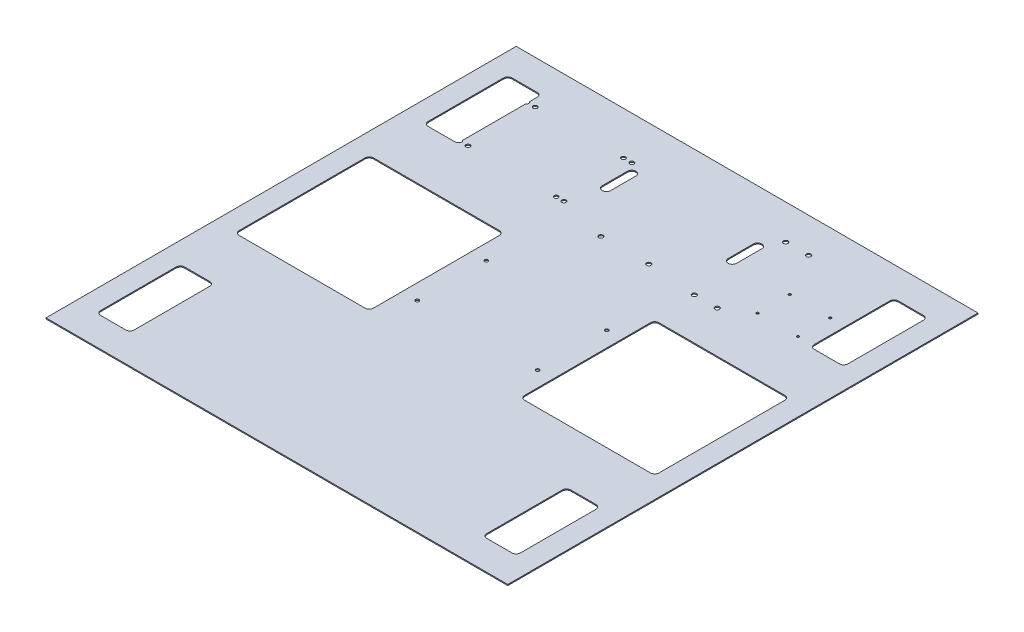
from build123d import *

# Parameters (mm, degrees)
SKETCH1_W           = 698.5
SKETCH1_H           = 711.2
SKETCH1_W_2         = 203.2
SKETCH1_H_2         = 203.2
BOSS_EXTRUDE1_DEPTH = 1.5875
FILLET1_R           = 6.35
SKETCH2_R           = 2.667
SKETCH2_R_2         = 3.429
SKETCH2_R_3         = 3.175
SKETCH2_R_4         = 3.3782
SKETCH2_R_5         = 1.838164507
SKETCH2_R_6         = 1.838724473
CUT_EXTRUDE1_DEPTH  = 997.850144283
SKETCH3_W           = 50.8
SKETCH3_H           = 127
CUT_EXTRUDE2_DEPTH  = 997.850144283
SKETCH4_W           = 12.7
SKETCH4_H           = 50.8
CUT_EXTRUDE3_DEPTH  = 997.850144283
FILLET2_R           = 6.35


with BuildPart() as part:
    # Sketch1 → Boss-Extrude1 (new body)
    with BuildSketch(Plane(origin=(0, 0, 0), x_dir=(1, 0, 0), z_dir=(0, 1, 0))):
        with Locations((349.25, -355.6)):
            Rectangle(SKETCH1_W, SKETCH1_H)
        with Locations((133.35, -355.6)):
            Rectangle(SKETCH1_W_2, SKETCH1_H_2, mode=Mode.SUBTRACT)
        with Locations((565.15, -355.6)):
            Rectangle(SKETCH1_W_2, SKETCH1_H_2, mode=Mode.SUBTRACT)
    extrude(amount=BOSS_EXTRUDE1_DEPTH)

    # Fillet1
    fillet1_edges = [part.edges().sort_by_distance(p)[0] for p in [
        (31.75, 0.79375, 254),
        (31.75, 0.79375, 457.2),
        (234.95, 0.79375, 457.2),
        (234.95, 0.79375, 254),
        (463.55, 0.79375, 254),
        (463.55, 0.79375, 457.2),
        (666.75, 0.79375, 457.2),
        (666.75, 0.79375, 254),
    ]]
    fillet(fillet1_edges, radius=FILLET1_R)

    # Sketch2 → Cut-Extrude1 (cut, through all)
    with BuildSketch(Plane(origin=(0, 1.5875, 0), x_dir=(1, 0, 0), z_dir=(0, 1, 0))):
        with Locations(Location((440.3852, -407.797, 0), (0, 0, 270))):
            Circle(SKETCH2_R)
        with Locations(Location((258.1148, -407.797, 0), (0, 0, 270))):
            Circle(SKETCH2_R)
        with Locations(Location((258.1148, -303.403, 0), (0, 0, 270))):
            Circle(SKETCH2_R)
        with Locations(Location((440.3852, -303.403, 0), (0, 0, 270))):
            Circle(SKETCH2_R)
        with Locations(Location((460.248, -190.725477854, 0), (0, 0, 270))):
            Circle(SKETCH2_R_2)
        with Locations(Location((494.792, -190.725477854, 0), (0, 0, 270))):
            Circle(SKETCH2_R_2)
        with Locations(Location((460.278515752, -52.578, 0), (0, 0, 270))):
            Circle(SKETCH2_R_2)
        with Locations(Location((494.822515752, -52.578, 0), (0, 0, 270))):
            Circle(SKETCH2_R_2)
        with Locations(Location((227.307398857, -65.109713759, 0), (0, 0, 270))):
            Circle(SKETCH2_R_3)
        with Locations(Location((227.307398857, -166.709713759, 0), (0, 0, 270))):
            Circle(SKETCH2_R_3)
        with Locations(Location((93.864461583, -166.709713759, 0), (0, 0, 270))):
            Circle(SKETCH2_R_3)
        with Locations(Location((93.864461583, -65.109713759, 0), (0, 0, 270))):
            Circle(SKETCH2_R_3)
        with Locations(Location((81.164461583, -65.109713759, 0), (0, 0, 270))):
            Circle(SKETCH2_R_3)
        with Locations(Location((81.164461583, -166.709713759, 0), (0, 0, 270))):
            Circle(SKETCH2_R_3)
        with Locations(Location((238.899461934, -166.709713759, 0), (0, 0, 270))):
            Circle(SKETCH2_R_3)
        with Locations(Location((240.007398857, -65.109713759, 0), (0, 0, 270))):
            Circle(SKETCH2_R_3)
        with Locations(Location((385.445, -184.896187086, 0), (0, 0, 270))):
            Circle(SKETCH2_R_4)
        with Locations(Location((313.055, -184.896187086, 0), (0, 0, 270))):
            Circle(SKETCH2_R_4)
        with Locations(Location((593.125050357, -166.962566622, 0), (0, 0, 270))):
            Circle(SKETCH2_R_5)
        with Locations(Location((532.098143635, -166.962566622, 0), (0, 0, 270))):
            Circle(SKETCH2_R_6)
        with Locations(Location((532.083268617, -118.12580583, 0), (0, 0, 270))):
            Circle(SKETCH2_R_6)
        with Locations(Location((593.11017534, -118.12580583, 0), (0, 0, 270))):
            Circle(SKETCH2_R_5)
    extrude(amount=-CUT_EXTRUDE1_DEPTH, mode=Mode.SUBTRACT)

    # Sketch3 → Cut-Extrude2 (cut, through all)
    with BuildSketch(Plane(origin=(0, 1.5875, 0), x_dir=(1, 0, 0), z_dir=(0, 1, 0))):
        with Locations((641.35, -107.95)):
            Rectangle(SKETCH3_W, SKETCH3_H)
        with Locations((57.15, -107.95)):
            Rectangle(SKETCH3_W, SKETCH3_H)
        with Locations((57.15, -603.25)):
            Rectangle(SKETCH3_W, SKETCH3_H)
        with Locations((641.35, -603.25)):
            Rectangle(SKETCH3_W, SKETCH3_H)
    extrude(amount=-CUT_EXTRUDE2_DEPTH, mode=Mode.SUBTRACT)

    # Sketch4 → Cut-Extrude3 (cut, through all)
    with BuildSketch(Plane(origin=(0, 1.5875, 0), x_dir=(1, 0, 0), z_dir=(0, 1, 0))):
        with Locations((444.5, -98.425)):
            Rectangle(SKETCH4_W, SKETCH4_H)
        with Locations((254, -98.425)):
            Rectangle(SKETCH4_W, SKETCH4_H)
    extrude(amount=-CUT_EXTRUDE3_DEPTH, mode=Mode.SUBTRACT)

    # Fillet2
    # the kernel refuses this fillet: 6.35 mm, written as the material it adds along each edge
    with BuildSketch(Plane(origin=(438.15, 1.5875, 73.025), x_dir=(0, 0, 1), z_dir=(0, -1, 0)), Plane(origin=(450.85, 1.5875, 73.025), x_dir=(-1, 0, 0), z_dir=(0, -1, 0)), Plane(origin=(260.35, 1.5875, 73.025), x_dir=(-1, 0, 0), z_dir=(0, -1, 0)), Plane(origin=(247.65, 1.5875, 73.025), x_dir=(0, 0, 1), z_dir=(0, -1, 0)), Plane(origin=(260.35, 1.5875, 123.825), x_dir=(0, 0, -1), z_dir=(0, -1, 0)), Plane(origin=(450.85, 1.5875, 123.825), x_dir=(0, 0, -1), z_dir=(0, -1, 0)), Plane(origin=(82.55, 1.5875, 44.45), x_dir=(-1, 0, 0), z_dir=(0, -1, 0)), Plane(origin=(31.75, 1.5875, 44.45), x_dir=(0, 0, 1), z_dir=(0, -1, 0)), Plane(origin=(31.75, 1.5875, 171.45), x_dir=(1, 0, 0), z_dir=(0, -1, 0)), Plane(origin=(615.95, 1.5875, 44.45), x_dir=(0, 0, 1), z_dir=(0, -1, 0)), Plane(origin=(666.75, 1.5875, 44.45), x_dir=(-1, 0, 0), z_dir=(0, -1, 0)), Plane(origin=(31.75, 1.5875, 539.75), x_dir=(0, 0, 1), z_dir=(0, -1, 0)), Plane(origin=(31.75, 1.5875, 666.75), x_dir=(1, 0, 0), z_dir=(0, -1, 0)), Plane(origin=(615.95, 1.5875, 539.75), x_dir=(0, 0, 1), z_dir=(0, -1, 0)), Plane(origin=(666.75, 1.5875, 539.75), x_dir=(-1, 0, 0), z_dir=(0, -1, 0))) as fillet2_piece_1:
        with BuildLine():
            CenterArc((FILLET2_R, -FILLET2_R), FILLET2_R, 90, 90)
            Line((0, -FILLET2_R), (-FILLET2_R * 0.02, -FILLET2_R))
            Line((-FILLET2_R * 0.02, -FILLET2_R), (-FILLET2_R * 0.02, FILLET2_R * 0.02))
            Line((-FILLET2_R * 0.02, FILLET2_R * 0.02), (FILLET2_R, FILLET2_R * 0.02))
            Line((FILLET2_R, FILLET2_R * 0.02), (FILLET2_R, 0))
        make_face()
    extrude(amount=1.5875)
    with BuildSketch(Plane(origin=(247.65, 1.5875, 123.825), x_dir=(0, 0, -1), z_dir=(0, -1, 0)), Plane(origin=(438.15, 1.5875, 123.825), x_dir=(0, 0, -1), z_dir=(0, -1, 0)), Plane(origin=(615.95, 1.5875, 171.45), x_dir=(0, 0, -1), z_dir=(0, -1, 0)), Plane(origin=(666.75, 1.5875, 171.45), x_dir=(-1, 0, 0), z_dir=(0, -1, 0)), Plane(origin=(82.55, 1.5875, 539.75), x_dir=(0, 0, 1), z_dir=(0, -1, 0)), Plane(origin=(82.55, 1.5875, 666.75), x_dir=(-1, 0, 0), z_dir=(0, -1, 0)), Plane(origin=(615.95, 1.5875, 666.75), x_dir=(0, 0, -1), z_dir=(0, -1, 0)), Plane(origin=(666.75, 1.5875, 666.75), x_dir=(-1, 0, 0), z_dir=(0, -1, 0))) as fillet2_piece_2:
        with BuildLine():
            CenterArc((FILLET2_R, FILLET2_R), FILLET2_R, 180, 90)
            Line((0, FILLET2_R), (-FILLET2_R * 0.02, FILLET2_R))
            Line((-FILLET2_R * 0.02, FILLET2_R), (-FILLET2_R * 0.02, -FILLET2_R * 0.02))
            Line((-FILLET2_R * 0.02, -FILLET2_R * 0.02), (FILLET2_R, -FILLET2_R * 0.02))
            Line((FILLET2_R, -FILLET2_R * 0.02), (FILLET2_R, 0))
        make_face()
    extrude(amount=1.5875)
    with BuildSketch(Plane(origin=(82.55, 1.5875, 171.45), x_dir=(0, 0, -1), z_dir=(0, -1, 0))) as fillet2_piece_3:
        with BuildLine():
            CenterArc((6.35, -4.51368774), FILLET2_R, 134.698575063, 45.301424937)
            Line((0, -4.51368774), (-0.127, -4.51368774))
            Line((-0.127, -4.51368774), (-0.127, 0))
            Line((-0.127, 0), (0, 0.127))
            ThreePointArc((0, 0.127), (0.941777945, 0.127), (1.794227008, 0.090273755))
            Line((1.794227008, 0.090273755), (1.88355589, 0))
        make_face()
    extrude(amount=1.5875)


solid = part.part
